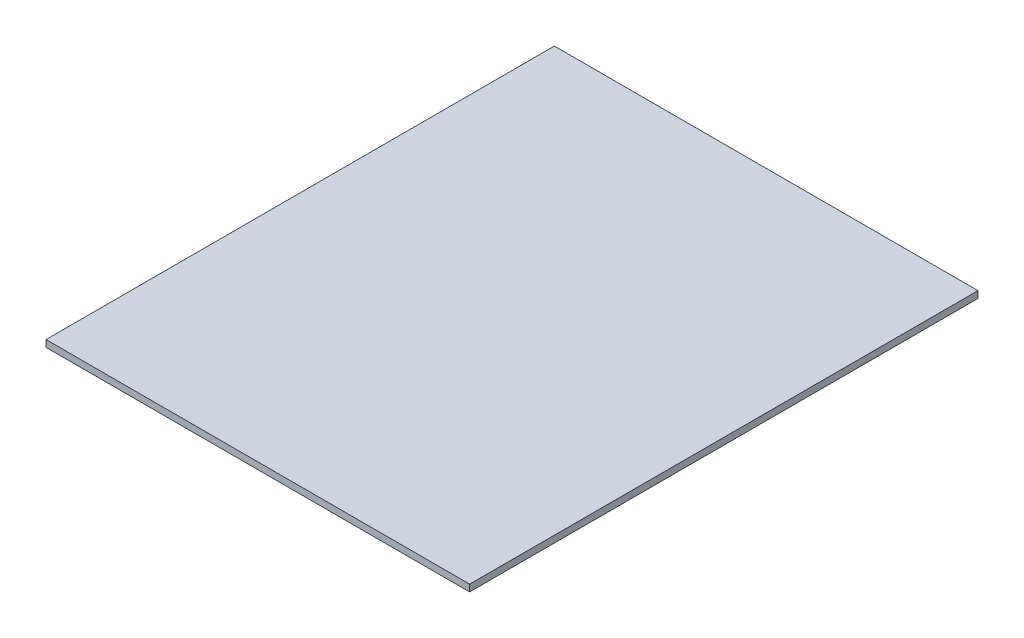
from build123d import *

# Parameters (mm, degrees)
SKETCH1_W           = 100
SKETCH1_H           = 120
BOSS_EXTRUDE1_DEPTH = 1.6


with BuildPart() as part:
    # Sketch1 → Boss-Extrude1 (new body)
    with BuildSketch(Plane(origin=(0, 0, 0), x_dir=(1, 0, 0), z_dir=(0, 1, 0))):
        Rectangle(SKETCH1_W, SKETCH1_H)
    extrude(amount=BOSS_EXTRUDE1_DEPTH)


solid = part.part
